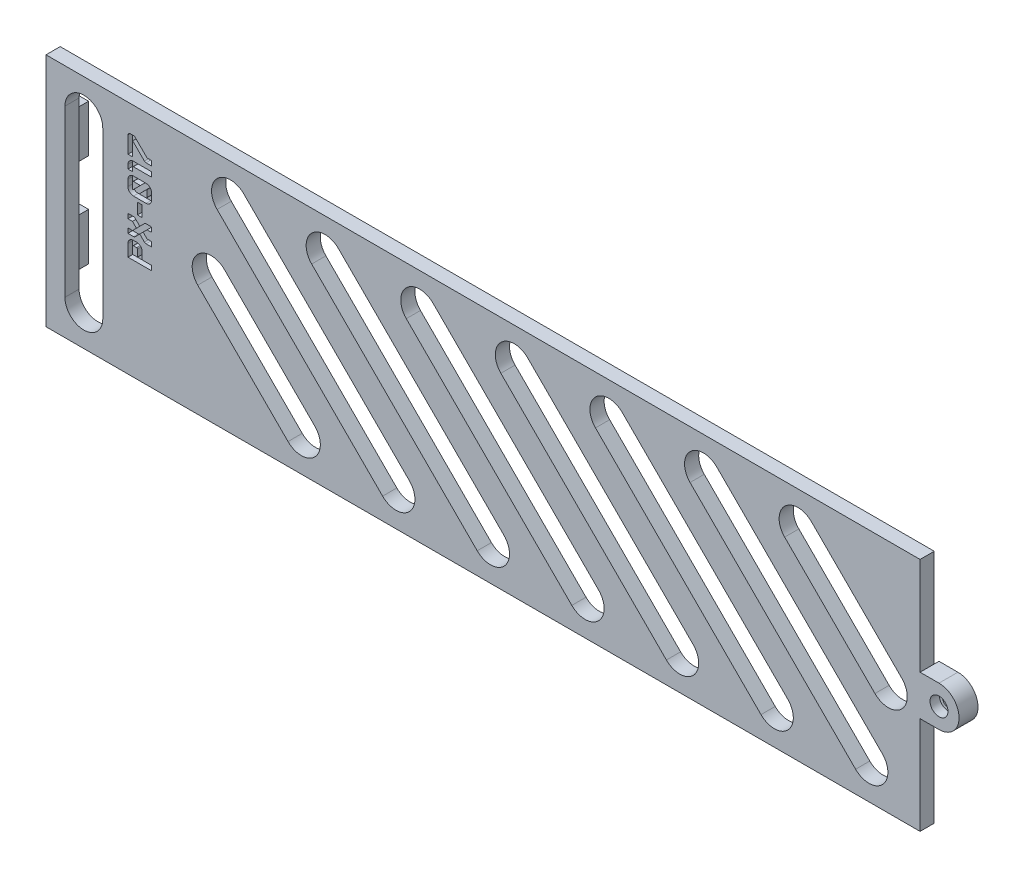
from build123d import *

# Parameters (mm, degrees)
ESQUISSE1_W                 = 184.8
ESQUISSE1_H                 = 49.8
BOSS_EXTRU_1_DEPTH          = 3
ESQUISSE2_W                 = 6
ESQUISSE2_H                 = 10
BOSS_EXTRU_2_DEPTH          = 3
ESQUISSE3_R                 = 1.25
BOSS_EXTRU_3_DEPTH          = 4
ESQUISSE4_R                 = 1.9
ENL_V_MAT_EXTRU_1_DEPTH     = 2
ENL_V_MAT_EXTRU_2_DEPTH     = 4
ENL_V_START                 = 2
ENL_V_MAT_EXTRU_3_OUTLINE_W = 1.000413394
ENL_V_MAT_EXTRU_3_OUTLINE_H = 2.335675899
ENL_V_MAT_EXTRU_3_DEPTH     = 1


# Read off the part's stored shape, not the designer's step: Enlèv. mat.-Extru.3
with BuildPart() as part:
    # Esquisse1 → Boss.-Extru.1 (new body)
    with BuildSketch(Plane.XY):
        Rectangle(ESQUISSE1_W, ESQUISSE1_H)
    extrude(amount=BOSS_EXTRU_1_DEPTH)

    # Esquisse2 → Boss.-Extru.2 (add)
    with BuildSketch(Plane(origin=(0, 0, 0), x_dir=(-1, 0, 0), z_dir=(0, 0, -1))):
        with Locations((92.4, -9.9)):
            Rectangle(ESQUISSE2_W, ESQUISSE2_H)
        with Locations((92.4, 9.9)):
            Rectangle(ESQUISSE2_W, ESQUISSE2_H)
    extrude(amount=BOSS_EXTRU_2_DEPTH)

    # Esquisse3 → Boss.-Extru.3 (add)
    with BuildSketch(Plane.XY.offset(3)):
        with BuildLine():
            Line((92.4, -4.25), (92.4, 4.25))
            Line((92.4, 4.25), (96.4, 4.25))
            ThreePointArc((96.4, 4.25), (100.65, 0), (96.4, -4.25))
            Line((96.4, -4.25), (92.4, -4.25))
        make_face()
        with Locations((96.4, 0)):
            Circle(ESQUISSE3_R, mode=Mode.SUBTRACT)
    extrude(amount=-BOSS_EXTRU_3_DEPTH)

    # Esquisse4 → Enlèv. mat.-Extru.1 (cut)
    with BuildSketch(Plane.XY.offset(3)):
        with Locations((96.4, 0)):
            Circle(ESQUISSE4_R)
    extrude(amount=-ENL_V_MAT_EXTRU_1_DEPTH, mode=Mode.SUBTRACT)

    # Esquisse5 → Enlèv. mat.-Extru.2 (cut)
    with BuildSketch(Plane.XY.offset(3)):
        with BuildLine():
            Line((-80.4, -17.5), (-80.4, 17.5))
            ThreePointArc((-80.4, 17.5), (-84.4, 21.5), (-88.4, 17.5))
            Line((-88.4, 17.5), (-88.4, -17.5))
            ThreePointArc((-88.4, -17.5), (-84.4, -21.5), (-80.4, -17.5))
        make_face()
        with BuildLine():
            Line((-35.571572875, -14.671572875), (-54.663455967, 4.420310217))
            ThreePointArc((-54.663455967, 4.420310217), (-60.320310217, 4.420310217), (-60.320310217, -1.236544033))
            Line((-60.320310217, -1.236544033), (-41.228427125, -20.328427125))
            ThreePointArc((-41.228427125, -20.328427125), (-35.571572875, -20.328427125), (-35.571572875, -14.671572875))
        make_face()
        with BuildLine():
            Line((-56.228427125, 14.671572875), (-21.228427125, -20.328427125))
            ThreePointArc((-21.228427125, -20.328427125), (-15.571572875, -20.328427125), (-15.571572875, -14.671572875))
            Line((-15.571572875, -14.671572875), (-50.571572875, 20.328427125))
            ThreePointArc((-50.571572875, 20.328427125), (-56.228427125, 20.328427125), (-56.228427125, 14.671572875))
        make_face()
        with BuildLine():
            Line((-36.228427125, 14.671572875), (-1.228427125, -20.328427125))
            ThreePointArc((-1.228427125, -20.328427125), (4.428427125, -20.328427125), (4.428427125, -14.671572875))
            Line((4.428427125, -14.671572875), (-30.571572875, 20.328427125))
            ThreePointArc((-30.571572875, 20.328427125), (-36.228427125, 20.328427125), (-36.228427125, 14.671572875))
        make_face()
        with BuildLine():
            Line((-16.228427125, 14.671572875), (18.771572875, -20.328427125))
            ThreePointArc((18.771572875, -20.328427125), (24.428427125, -20.328427125), (24.428427125, -14.671572875))
            Line((24.428427125, -14.671572875), (-10.571572875, 20.328427125))
            ThreePointArc((-10.571572875, 20.328427125), (-16.228427125, 20.328427125), (-16.228427125, 14.671572875))
        make_face()
        with BuildLine():
            Line((3.771572875, 14.671572875), (38.771572875, -20.328427125))
            ThreePointArc((38.771572875, -20.328427125), (44.428427125, -20.328427125), (44.428427125, -14.671572875))
            Line((44.428427125, -14.671572875), (9.428427125, 20.328427125))
            ThreePointArc((9.428427125, 20.328427125), (3.771572875, 20.328427125), (3.771572875, 14.671572875))
        make_face()
        with BuildLine():
            Line((23.771572875, 14.671572875), (58.771572875, -20.328427125))
            ThreePointArc((58.771572875, -20.328427125), (64.428427125, -20.328427125), (64.428427125, -14.671572875))
            Line((64.428427125, -14.671572875), (29.428427125, 20.328427125))
            ThreePointArc((29.428427125, 20.328427125), (23.771572875, 20.328427125), (23.771572875, 14.671572875))
        make_face()
        with BuildLine():
            Line((43.771572875, 14.671572875), (78.771572875, -20.328427125))
            ThreePointArc((78.771572875, -20.328427125), (84.428427125, -20.328427125), (84.428427125, -14.671572875))
            Line((84.428427125, -14.671572875), (49.428427125, 20.328427125))
            ThreePointArc((49.428427125, 20.328427125), (43.771572875, 20.328427125), (43.771572875, 14.671572875))
        make_face()
        with BuildLine():
            Line((88.520310217, 1.236544033), (69.428427125, 20.328427125))
            ThreePointArc((69.428427125, 20.328427125), (63.771572875, 20.328427125), (63.771572875, 14.671572875))
            Line((63.771572875, 14.671572875), (82.863455967, -4.420310217))
            ThreePointArc((82.863455967, -4.420310217), (88.520310217, -4.420310217), (88.520310217, 1.236544033))
        make_face()
    extrude(amount=-ENL_V_MAT_EXTRU_2_DEPTH, mode=Mode.SUBTRACT)

    # Enlèv. mat.-Extru.3 outline → Enlèv. mat.-Extru.3 (cut)
    # profile 1 of 6: a face of its own
    with BuildSketch(Plane.XY.offset(ENL_V_START)):
        with BuildLine():
            add(Edge.make_bspline(
                [(-75.065144315, -0.99193391), (-75.064269585, -0.952254972), (-75.06254263, -0.873917923), (-75.045312601, -0.759032094), (-75.018482024, -0.648606975), (-74.98119093, -0.542968356), (-74.933672422, -0.441786091), (-74.873741945, -0.34652213), (-74.804610007, -0.254470365), (-74.75056596, -0.19869811), (-74.723060809, -0.170313405)],
                knots=[0, 0, 0, 0, 0.130010674, 0.256676541, 0.379948248, 0.502118087, 0.62337082, 0.745608512, 0.870530118, 1, 1, 1, 1], degree=3))
            Line((-75.065144315, -0.99193391), (-75.065144315, -3.49193391))
            Line((-75.065144315, -3.49193391), (-70.065144315, -3.49193391))
            Line((-70.065144315, -3.49193391), (-70.072378709, -2.492554001))
            Line((-70.072378709, -2.492554001), (-72.072172012, -2.492554001))
            Line((-72.072172012, -2.492554001), (-72.072172012, -0.99193391))
            add(Edge.make_bspline(
                [(-72.415289003, -0.170313405), (-72.387791464, -0.198701765), (-72.333762375, -0.2544812), (-72.264522047, -0.346480928), (-72.20491191, -0.442063062), (-72.155870605, -0.542681576), (-72.118916712, -0.64864653), (-72.091981007, -0.759021189), (-72.074779618, -0.873920765), (-72.073048733, -0.952255927), (-72.072172012, -0.99193391)],
                knots=[0, 0, 0, 0, 0.129406701, 0.254267345, 0.376445385, 0.498126946, 0.620237166, 0.743448717, 0.870052771, 1, 1, 1, 1], degree=3))
            add(Edge.make_bspline(
                [(-73.236909507, 0.1717701), (-73.197568756, 0.170927451), (-73.120246151, 0.169271258), (-73.006472548, 0.151650794), (-72.89693608, 0.125368731), (-72.791579647, 0.087341149), (-72.689866392, 0.040369647), (-72.593589261, -0.019627897), (-72.500496125, -0.088726583), (-72.444020492, -0.142802666), (-72.415289003, -0.170313405)],
                knots=[0, 0, 0, 0, 0.12897448, 0.253493958, 0.376853843, 0.498045824, 0.620407501, 0.743694873, 0.869606985, 1, 1, 1, 1], degree=3))
            Line((-73.236909507, 0.1717701), (-73.901440305, 0.1717701))
            add(Edge.make_bspline(
                [(-74.723060809, -0.170313405), (-74.694676105, -0.142808254), (-74.63890385, -0.088764208), (-74.546852084, -0.019632269), (-74.451588123, 0.040298207), (-74.350405859, 0.087816716), (-74.24476724, 0.12510781), (-74.134342121, 0.151938386), (-74.019456291, 0.169168416), (-73.941119242, 0.170895371), (-73.901440305, 0.1717701)],
                knots=[0, 0, 0, 0, 0.129469882, 0.254391488, 0.37662918, 0.497881913, 0.620051752, 0.743323459, 0.869989326, 1, 1, 1, 1], degree=3))
        make_face()
        with BuildLine():
            add(Edge.make_bspline(
                [(-73.901440305, -0.827609809), (-73.923770007, -0.829480983), (-73.967501095, -0.833145542), (-74.021896697, -0.871477517), (-74.060228673, -0.92587312), (-74.063893231, -0.969604207), (-74.065764406, -0.99193391)],
                knots=[0, 0, 0, 0, 0.255306965, 0.5, 0.744693035, 1, 1, 1, 1], degree=3))
            Line((-73.901440305, -0.827609809), (-73.236909507, -0.827609809))
            add(Edge.make_bspline(
                [(-73.072585406, -0.99193391), (-73.074456581, -0.969604207), (-73.078121139, -0.92587312), (-73.116453114, -0.871477517), (-73.170848717, -0.833145542), (-73.214579805, -0.829480983), (-73.236909507, -0.827609809)],
                knots=[0, 0, 0, 0, 0.255306965, 0.5, 0.744693035, 1, 1, 1, 1], degree=3))
            Line((-73.072585406, -0.99193391), (-73.065351012, -2.492554001))
            Line((-73.065351012, -2.492554001), (-74.065764406, -2.492554001))
            Line((-74.065764406, -2.492554001), (-74.065764406, -0.99193391))
        make_face(mode=Mode.SUBTRACT)
    # profile 2 of 6: a face of its own
    with BuildSketch(Plane.XY.offset(ENL_V_START)):
        with BuildLine():
            add(Edge.make_bspline(
                [(-73.908674699, 4.537210365), (-73.874066606, 4.535352166), (-73.806929775, 4.531747415), (-73.710362598, 4.505694796), (-73.623828745, 4.459386458), (-73.575458828, 4.416298287), (-73.55108892, 4.394589447)],
                knots=[0, 0, 0, 0, 0.262612483, 0.509446439, 0.752847521, 1, 1, 1, 1], degree=3))
            Line((-73.908674699, 4.537210365), (-75.072378709, 4.537210365))
            Line((-75.072378709, 4.537210365), (-75.072378709, 3.537830456))
            Line((-75.072378709, 3.537830456), (-74.115371681, 3.537830456))
            Line((-74.115371681, 3.537830456), (-73.279282388, 2.701741163))
            Line((-73.279282388, 2.701741163), (-74.115371681, 1.86565187))
            Line((-74.115371681, 1.86565187), (-75.072378709, 1.86565187))
            Line((-75.072378709, 1.86565187), (-75.072378709, 0.866271961))
            Line((-75.072378709, 0.866271961), (-73.908674699, 0.866271961))
            add(Edge.make_bspline(
                [(-73.55108892, 1.008892878), (-73.575399089, 0.987058696), (-73.623529872, 0.943830023), (-73.710847964, 0.899354181), (-73.806699475, 0.871320741), (-73.874019948, 0.867987713), (-73.908674699, 0.866271961)],
                knots=[0, 0, 0, 0, 0.247281059, 0.48958242, 0.737250893, 1, 1, 1, 1], degree=3))
            Line((-73.55108892, 1.008892878), (-72.572378709, 1.987603089))
            Line((-72.572378709, 1.987603089), (-71.593668498, 1.008892878))
            add(Edge.make_bspline(
                [(-71.237116204, 0.866271961), (-71.271422751, 0.868016022), (-71.338390778, 0.871420513), (-71.433909212, 0.899353492), (-71.521227608, 0.943830198), (-71.56935835, 0.987058754), (-71.593668498, 1.008892878)],
                knots=[0, 0, 0, 0, 0.260822608, 0.50913826, 0.752072775, 1, 1, 1, 1], degree=3))
            Line((-71.237116204, 0.866271961), (-70.072378709, 0.866271961))
            Line((-70.072378709, 0.866271961), (-70.072378709, 1.86565187))
            Line((-70.072378709, 1.86565187), (-71.029385737, 1.86565187))
            Line((-71.029385737, 1.86565187), (-71.86547503, 2.701741163))
            Line((-71.86547503, 2.701741163), (-71.029385737, 3.537830456))
            Line((-71.029385737, 3.537830456), (-70.072378709, 3.537830456))
            Line((-70.072378709, 3.537830456), (-70.072378709, 4.537210365))
            Line((-70.072378709, 4.537210365), (-71.237116204, 4.537210365))
            add(Edge.make_bspline(
                [(-71.593668498, 4.394589447), (-71.569298596, 4.416298182), (-71.52092869, 4.459386145), (-71.434394755, 4.505696033), (-71.338162027, 4.53165245), (-71.271376763, 4.5353259), (-71.237116204, 4.537210365)],
                knots=[0, 0, 0, 0, 0.247797972, 0.49183475, 0.739313368, 1, 1, 1, 1], degree=3))
            Line((-71.593668498, 4.394589447), (-72.572378709, 3.415879236))
            Line((-72.572378709, 3.415879236), (-73.55108892, 4.394589447))
        make_face()
    # profile 3 of 6: a face of its own
    with BuildSketch(Plane.XY.offset(ENL_V_START)):
        with BuildLine():
            add(Edge.make_bspline(
                [(-73.908674699, 8.281526198), (-73.948015418, 8.28236888), (-74.02533796, 8.284025135), (-74.13911202, 8.301645142), (-74.248646792, 8.327928902), (-74.354009465, 8.365950244), (-74.455699242, 8.412945225), (-74.552065455, 8.472853685), (-74.644814705, 8.542296258), (-74.73135518, 8.622549727), (-74.811608649, 8.709090203), (-74.881051222, 8.801839452), (-74.940959682, 8.898205666), (-74.987954663, 8.999895443), (-75.025976006, 9.105258115), (-75.052259765, 9.214792887), (-75.069879772, 9.328566947), (-75.071536028, 9.405889489), (-75.072378709, 9.445230208)],
                knots=[0, 0, 0, 0, 0.06448724, 0.126746979, 0.188426922, 0.249022912, 0.31020375, 0.371847437, 0.434803492, 0.5, 0.565196508, 0.628152563, 0.68979625, 0.750977088, 0.811573078, 0.873253021, 0.93551276, 1, 1, 1, 1], degree=3))
            Line((-73.908674699, 8.281526198), (-71.237116204, 8.281526198))
            add(Edge.make_bspline(
                [(-70.072378709, 9.445230208), (-70.073223341, 9.405890415), (-70.074883431, 9.328569694), (-70.092475532, 9.214782381), (-70.118862994, 9.10529686), (-70.156552509, 8.999613617), (-70.205068742, 8.898481299), (-70.264653067, 8.801798299), (-70.334206599, 8.70910177), (-70.414429096, 8.622546578), (-70.500977908, 8.54229707), (-70.593725007, 8.472853476), (-70.690091778, 8.41294528), (-70.791781408, 8.36595023), (-70.89714412, 8.327928906), (-71.006678881, 8.301645141), (-71.120452943, 8.284025135), (-71.197775485, 8.28236888), (-71.237116204, 8.281526198)],
                knots=[0, 0, 0, 0, 0.064471621, 0.126716281, 0.188381284, 0.248962598, 0.31037082, 0.371999576, 0.434940384, 0.500121101, 0.565301818, 0.628242625, 0.689871381, 0.751037402, 0.811618716, 0.873283719, 0.935528379, 1, 1, 1, 1], degree=3))
            Line((-70.072378709, 9.445230208), (-70.072378709, 10.781526198))
            add(Edge.make_bspline(
                [(-70.4154957, 11.603146702), (-70.387998161, 11.574758343), (-70.333969072, 11.518978907), (-70.264728744, 11.426979179), (-70.205118607, 11.331397045), (-70.156077302, 11.230778532), (-70.119123409, 11.124813578), (-70.092187704, 11.014438919), (-70.074986315, 10.899539342), (-70.07325543, 10.82120418), (-70.072378709, 10.781526198)],
                knots=[0, 0, 0, 0, 0.129406701, 0.254267345, 0.376445385, 0.498126946, 0.620237166, 0.743448717, 0.870052771, 1, 1, 1, 1], degree=3))
            add(Edge.make_bspline(
                [(-71.237116204, 11.945230208), (-71.197775453, 11.944387558), (-71.120452848, 11.942731365), (-71.006679245, 11.925110902), (-70.897142777, 11.898828838), (-70.791786343, 11.860801257), (-70.690073088, 11.813829754), (-70.593795958, 11.75383221), (-70.500702822, 11.684733525), (-70.444227189, 11.630657442), (-70.4154957, 11.603146702)],
                knots=[0, 0, 0, 0, 0.12897448, 0.253493958, 0.376853843, 0.498045824, 0.620407501, 0.743694873, 0.869606985, 1, 1, 1, 1], degree=3))
            Line((-71.237116204, 11.945230208), (-73.908674699, 11.945230208))
            add(Edge.make_bspline(
                [(-74.730295204, 11.603146702), (-74.701563714, 11.630657442), (-74.645088081, 11.684733525), (-74.551994945, 11.75383221), (-74.455717815, 11.813829754), (-74.35400456, 11.860801257), (-74.248648126, 11.898828838), (-74.139111658, 11.925110902), (-74.025338055, 11.942731365), (-73.94801545, 11.944387558), (-73.908674699, 11.945230208)],
                knots=[0, 0, 0, 0, 0.130393015, 0.256305127, 0.379592499, 0.501954176, 0.623146157, 0.746506042, 0.87102552, 1, 1, 1, 1], degree=3))
            add(Edge.make_bspline(
                [(-75.072378709, 10.781526198), (-75.07150398, 10.821205136), (-75.069777025, 10.899542184), (-75.052546995, 11.014428014), (-75.025716419, 11.124853133), (-74.988425324, 11.230491752), (-74.940906816, 11.331674016), (-74.88097634, 11.426937977), (-74.811844401, 11.518989743), (-74.757800355, 11.574761998), (-74.730295204, 11.603146702)],
                knots=[0, 0, 0, 0, 0.130010674, 0.256676541, 0.379948248, 0.502118087, 0.62337082, 0.745608512, 0.870530118, 1, 1, 1, 1], degree=3))
            Line((-75.072378709, 10.781526198), (-75.072378709, 9.445230208))
        make_face()
        with BuildLine():
            add(Edge.make_bspline(
                [(-73.908674699, 10.945850299), (-73.929557968, 10.943712127), (-73.972059475, 10.939360531), (-74.025803933, 10.901779435), (-74.066585408, 10.848160463), (-74.070841869, 10.803936415), (-74.0729988, 10.781526198)],
                knots=[0, 0, 0, 0, 0.24131746, 0.491127877, 0.742132716, 1, 1, 1, 1], degree=3))
            Line((-73.908674699, 10.945850299), (-72.44422658, 10.945850299))
            Line((-72.44422658, 10.945850299), (-74.044061223, 9.352216566))
            add(Edge.make_bspline(
                [(-74.0729988, 9.445230208), (-74.07208438, 9.427523815), (-74.070351717, 9.393973355), (-74.05249431, 9.365610709), (-74.044061223, 9.352216566)],
                knots=[0, 0, 0, 0, 0.527754097, 1, 1, 1, 1], degree=3))
            Line((-74.0729988, 9.445230208), (-74.0729988, 10.781526198))
        make_face(mode=Mode.SUBTRACT)
        with BuildLine():
            add(Edge.make_bspline(
                [(-71.237116204, 9.280906107), (-71.216164035, 9.283340047), (-71.173202629, 9.288330723), (-71.120191204, 9.328305208), (-71.080216719, 9.381316633), (-71.075226043, 9.424278039), (-71.072792103, 9.445230208)],
                knots=[0, 0, 0, 0, 0.243848737, 0.5, 0.756151263, 1, 1, 1, 1], degree=3))
            Line((-71.237116204, 9.280906107), (-72.701564323, 9.280906107))
            Line((-72.701564323, 9.280906107), (-71.100696196, 10.87453984))
            add(Edge.make_bspline(
                [(-71.072792103, 10.781526198), (-71.073780608, 10.799193259), (-71.075644721, 10.832509601), (-71.092689812, 10.861107089), (-71.100696196, 10.87453984)],
                knots=[0, 0, 0, 0, 0.530282136, 1, 1, 1, 1], degree=3))
            Line((-71.072792103, 10.781526198), (-71.072792103, 9.445230208))
        make_face(mode=Mode.SUBTRACT)
    # profile 4 of 6: a face of its own
    with BuildSketch(Plane.XY.offset(ENL_V_START)):
        with BuildLine():
            add(Edge.make_bspline(
                [(-75.072378709, 13.482022271), (-75.071536027, 13.52136299), (-75.069879772, 13.598685531), (-75.052259766, 13.712459594), (-75.025976002, 13.821994355), (-74.987954677, 13.927357067), (-74.940959627, 14.029046697), (-74.881051431, 14.125413468), (-74.811607837, 14.218160567), (-74.731358329, 14.304709379), (-74.644803137, 14.384931875), (-74.552106608, 14.454485408), (-74.455423609, 14.514069733), (-74.35429129, 14.562585966), (-74.248608047, 14.60027548), (-74.139122526, 14.626662943), (-74.025335213, 14.644255044), (-73.948014492, 14.645915133), (-73.908674699, 14.646759766)],
                knots=[0, 0, 0, 0, 0.064471621, 0.126716281, 0.188381284, 0.248962598, 0.310128619, 0.371757375, 0.434698182, 0.499878899, 0.565059616, 0.628000424, 0.68962918, 0.751037402, 0.811618716, 0.873283719, 0.935528379, 1, 1, 1, 1], degree=3))
            Line((-75.072378709, 13.482022271), (-75.072378709, 12.646966462))
            Line((-75.072378709, 12.646966462), (-74.0729988, 12.646966462))
            Line((-74.0729988, 12.646966462), (-74.0729988, 13.482022271))
            add(Edge.make_bspline(
                [(-73.908674699, 13.646346372), (-73.929626868, 13.643912432), (-73.972588274, 13.638921756), (-74.0255997, 13.598947271), (-74.065574184, 13.545935845), (-74.07056486, 13.50297444), (-74.0729988, 13.482022271)],
                knots=[0, 0, 0, 0, 0.243848737, 0.5, 0.756151263, 1, 1, 1, 1], degree=3))
            Line((-73.908674699, 13.646346372), (-70.072378709, 13.646346372))
            Line((-70.072378709, 13.646346372), (-70.072378709, 14.646759766))
            Line((-70.072378709, 14.646759766), (-73.908674699, 14.646759766))
        make_face()
    # profile 5 of 6: a face of its own
    with BuildSketch(Plane.XY.offset(ENL_V_START)):
        with BuildLine():
            add(Edge.make_bspline(
                [(-71.237116204, 15.69367998), (-71.269697884, 15.695487565), (-71.334271281, 15.699070002), (-71.427578768, 15.727286034), (-71.515966231, 15.772409114), (-71.56720814, 15.815225042), (-71.593668498, 15.837334383)],
                knots=[0, 0, 0, 0, 0.248214229, 0.491933996, 0.737644267, 1, 1, 1, 1], degree=3))
            Line((-71.237116204, 15.69367998), (-70.072378709, 15.69367998))
            Line((-70.072378709, 15.69367998), (-70.072378709, 16.694093374))
            Line((-70.072378709, 16.694093374), (-71.029385737, 16.694093374))
            Line((-71.029385737, 16.694093374), (-73.55108892, 19.208562163))
            add(Edge.make_bspline(
                [(-73.908674699, 19.358417475), (-73.875051711, 19.356711156), (-73.808997825, 19.353359015), (-73.713776097, 19.32419917), (-73.626284454, 19.27594787), (-73.576481816, 19.231317747), (-73.55108892, 19.208562163)],
                knots=[0, 0, 0, 0, 0.253036234, 0.497101158, 0.74358671, 1, 1, 1, 1], degree=3))
            Line((-73.908674699, 19.358417475), (-74.573205497, 19.358417475))
            add(Edge.make_bspline(
                [(-75.072378709, 18.858210778), (-75.070626104, 18.89182022), (-75.06720539, 18.957418733), (-75.039167527, 19.051830788), (-74.992948271, 19.138149097), (-74.928485391, 19.213935305), (-74.851956061, 19.277476384), (-74.766125625, 19.32547429), (-74.671667074, 19.353060231), (-74.606451384, 19.356608583), (-74.573205497, 19.358417475)],
                knots=[0, 0, 0, 0, 0.128226725, 0.25027142, 0.372762479, 0.499835513, 0.627920285, 0.751039164, 0.873083859, 1, 1, 1, 1], degree=3))
            Line((-75.072378709, 18.858210778), (-75.072378709, 15.358830869))
            Line((-75.072378709, 15.358830869), (-74.0729988, 15.358830869))
            Line((-74.0729988, 15.358830869), (-74.0729988, 18.3156312))
            Line((-74.0729988, 18.3156312), (-71.593668498, 15.837334383))
        make_face()
    # profile 6 of 6: a face of its own
    with BuildSketch(Plane.XY.offset(ENL_V_START)):
        with Locations((-72.572378709, 6.40678457)):
            Rectangle(ENL_V_MAT_EXTRU_3_OUTLINE_W, ENL_V_MAT_EXTRU_3_OUTLINE_H)
    extrude(amount=ENL_V_MAT_EXTRU_3_DEPTH, mode=Mode.SUBTRACT)


solid = part.part
